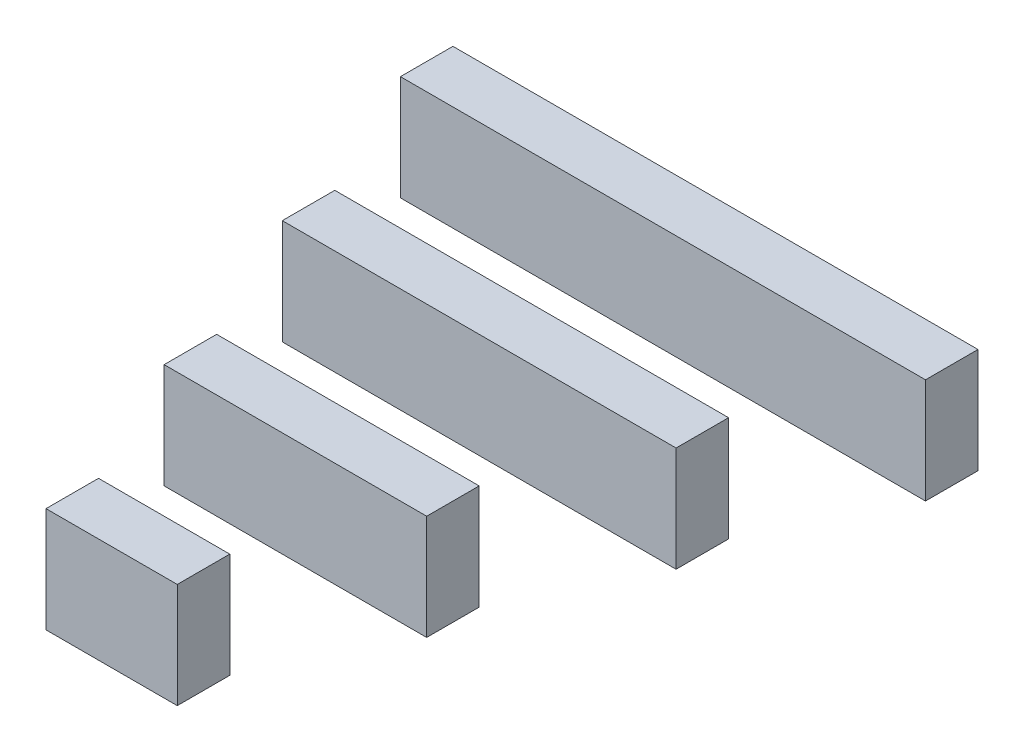
from build123d import *

# Parameters (mm, degrees)
SKETCH5_W             = 10
SKETCH5_H             = 4
BOSS_EXTRUDE4_DEPTH   = 8
SKETCH5_W_2           = 20
BOSS_EXTRUDE4_2_DEPTH = 8
SKETCH5_W_3           = 30
BOSS_EXTRUDE4_3_DEPTH = 8
SKETCH5_W_4           = 40
BOSS_EXTRUDE4_4_DEPTH = 8


with BuildPart() as part:
    # Sketch5 → Boss-Extrude4 (new body)
    with BuildSketch(Plane(origin=(0, 1, 0), x_dir=(1, 0, 0), z_dir=(0, 1, 0))):
        with Locations((0, -21)):
            Rectangle(SKETCH5_W, SKETCH5_H)
    extrude(amount=BOSS_EXTRUDE4_DEPTH)


with BuildPart() as body_2:
    # Sketch5 → Boss-Extrude4 2 (new body)
    with BuildSketch(Plane(origin=(0, 1, 0), x_dir=(1, 0, 0), z_dir=(0, 1, 0))):
        with Locations((0, -7)):
            Rectangle(SKETCH5_W_2, SKETCH5_H)
    extrude(amount=BOSS_EXTRUDE4_2_DEPTH)


with BuildPart() as body_3:
    # Sketch5 → Boss-Extrude4 3 (new body)
    with BuildSketch(Plane(origin=(0, 1, 0), x_dir=(1, 0, 0), z_dir=(0, 1, 0))):
        with Locations((0, 7)):
            Rectangle(SKETCH5_W_3, SKETCH5_H)
    extrude(amount=BOSS_EXTRUDE4_3_DEPTH)


with BuildPart() as body_4:
    # Sketch5 → Boss-Extrude4 4 (new body)
    with BuildSketch(Plane(origin=(0, 1, 0), x_dir=(1, 0, 0), z_dir=(0, 1, 0))):
        with Locations((0, 21)):
            Rectangle(SKETCH5_W_4, SKETCH5_H)
    extrude(amount=BOSS_EXTRUDE4_4_DEPTH)


solid = Compound([part.part, body_2.part, body_3.part, body_4.part])
